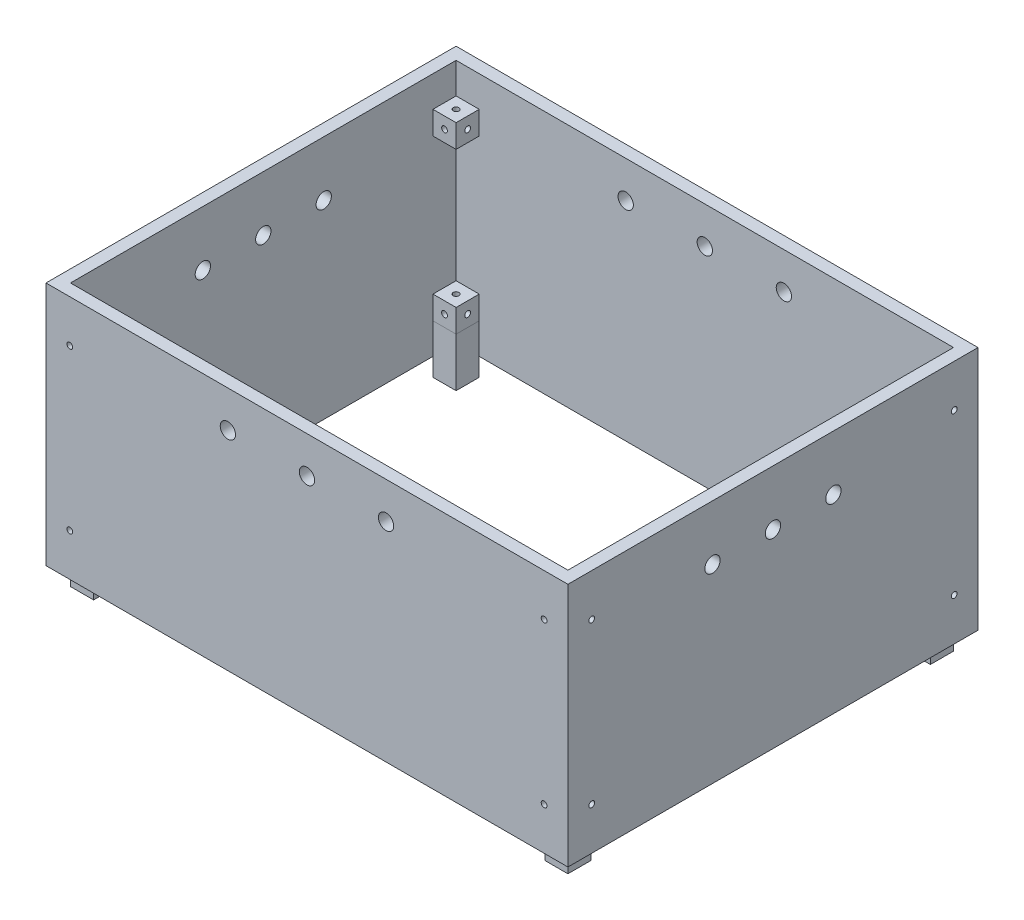
from build123d import *

# Parameters (mm, degrees)
SKETCH1_W            = 270.7
SKETCH1_H            = 212.7
SKETCH1_W_2          = 258
SKETCH1_H_2          = 200
WALLS_DEPTH          = 127
SKETCH2_R            = 3.96875
RODHOLESHEIGHT_DEPTH = 367.945200268
SKETCH4_R            = 3.96875
RODHOLESWIDTH_DEPTH  = 367.945200268
SKETCH3_W            = 12
SKETCH3_H            = 12
MODDINGCUBE_DEPTH    = 12
SKETCH11_R           = 1.5
CUT_EXTRUDE1_DEPTH   = 357.622226593
SKETCH17_R           = 1.5
CUT_EXTRUDE4_DEPTH   = 359.218899557
SKETCH15_R           = 1.5
CUT_EXTRUDE2_DEPTH   = 354.625243019
SKETCH18_W           = 12
SKETCH18_H           = 12
PEGS_DEPTH           = 25.4
PEGS_2_DEPTH         = 25.4
PEGS_3_DEPTH         = 25.4
PEGS_4_DEPTH         = 25.4


with BuildPart() as part:
    # Sketch1 → Walls (new body)
    with BuildSketch(Plane(origin=(0, 0, 0), x_dir=(1, 0, 0), z_dir=(0, 1, 0))):
        with Locations((135.35, 106.35)):
            Rectangle(SKETCH1_W, SKETCH1_H)
        with Locations((135.35, 106.35)):
            Rectangle(SKETCH1_W_2, SKETCH1_H_2, mode=Mode.SUBTRACT)
    extrude(amount=WALLS_DEPTH)

    # Sketch2 → RodHolesHeight (cut, through all)
    with BuildSketch(Plane.XY):
        with Locations((135.35, 107.95)):
            Circle(SKETCH2_R)
        with Locations((94.33, 107.95)):
            Circle(SKETCH2_R)
        with Locations((176.366666667, 107.95)):
            Circle(SKETCH2_R)
    extrude(amount=-RODHOLESHEIGHT_DEPTH, mode=Mode.SUBTRACT)

    # Sketch4 → RodHolesWidth (cut, through all)
    with BuildSketch(Plane.ZY):
        with Locations((-106.35, 98.425)):
            Circle(SKETCH4_R)
        with Locations((-137.7, 98.425)):
            Circle(SKETCH4_R)
        with Locations((-75, 98.425)):
            Circle(SKETCH4_R)
    extrude(amount=-RODHOLESWIDTH_DEPTH, mode=Mode.SUBTRACT)

    # Sketch3 → ModdingCube (add)
    with BuildSketch(Plane(origin=(0, 0, -6.35), x_dir=(-1, 0, 0), z_dir=(0, 0, -1))):
        with Locations((-258.35, 105)):
            Rectangle(SKETCH3_W, SKETCH3_H)
        with Locations((-258.35, 22)):
            Rectangle(SKETCH3_W, SKETCH3_H)
        with Locations((-12.35, 105)):
            Rectangle(SKETCH3_W, SKETCH3_H)
        with Locations((-12.35, 22)):
            Rectangle(SKETCH3_W, SKETCH3_H)
    moddingcube = extrude(amount=MODDINGCUBE_DEPTH)

    # Sketch11 → Cut-Extrude1 (cut, symmetric)
    with BuildSketch(Plane(origin=(0, 0, -18.35), x_dir=(-1, 0, 0), z_dir=(0, 0, -1))):
        with Locations((-258.35, 105)):
            Circle(SKETCH11_R)
        with Locations((-258.35, 22)):
            Circle(SKETCH11_R)
        with Locations((-12.35, 105)):
            Circle(SKETCH11_R)
        with Locations((-12.35, 22)):
            Circle(SKETCH11_R)
    cut_extrude1 = extrude(amount=CUT_EXTRUDE1_DEPTH, both=True, mode=Mode.SUBTRACT)

    # Sketch17 → Cut-Extrude4 (cut, symmetric)
    with BuildSketch(Plane(origin=(0, 28, 0), x_dir=(1, 0, 0), z_dir=(0, 1, 0))):
        with Locations((12.35, 12.35)):
            Circle(SKETCH17_R)
        with Locations((258.35, 12.35)):
            Circle(SKETCH17_R)
    cut_extrude4 = extrude(amount=CUT_EXTRUDE4_DEPTH, both=True, mode=Mode.SUBTRACT)

    # Sketch15 → Cut-Extrude2 (cut, symmetric)
    with BuildSketch(Plane.ZY.offset(-252.35)):
        with Locations((-12.35, 105)):
            Circle(SKETCH15_R)
        with Locations((-12.35, 22)):
            Circle(SKETCH15_R)
    cut_extrude2 = extrude(amount=CUT_EXTRUDE2_DEPTH, both=True, mode=Mode.SUBTRACT)

    # Mirror6: ModdingCube, Cut-Extrude1, Cut-Extrude4, Cut-Extrude2 across plane
    add(moddingcube.mirror(Plane(origin=(0, 0, -106.35), x_dir=(1, 0, 0), z_dir=(0, 0, -1))))
    add(cut_extrude1.mirror(Plane(origin=(0, 0, -106.35), x_dir=(1, 0, 0), z_dir=(0, 0, -1))), mode=Mode.SUBTRACT)
    add(cut_extrude4.mirror(Plane(origin=(0, 0, -106.35), x_dir=(1, 0, 0), z_dir=(0, 0, -1))), mode=Mode.SUBTRACT)
    add(cut_extrude2.mirror(Plane(origin=(0, 0, -106.35), x_dir=(1, 0, 0), z_dir=(0, 0, -1))), mode=Mode.SUBTRACT)


with BuildPart() as body_2:
    # Sketch18 → Pegs (new body)
    with BuildSketch(Plane.XZ.offset(-16)):
        with Locations((12.35, -12.35)):
            Rectangle(SKETCH18_W, SKETCH18_H)
    extrude(amount=PEGS_DEPTH)


with BuildPart() as body_3:
    # Sketch18 → Pegs 2 (new body)
    with BuildSketch(Plane.XZ.offset(-16)):
        with Locations((12.35, -200.35)):
            Rectangle(SKETCH18_W, SKETCH18_H)
    extrude(amount=PEGS_2_DEPTH)


with BuildPart() as body_4:
    # Sketch18 → Pegs 3 (new body)
    with BuildSketch(Plane.XZ.offset(-16)):
        with Locations((258.35, -200.35)):
            Rectangle(SKETCH18_W, SKETCH18_H)
    extrude(amount=PEGS_3_DEPTH)


with BuildPart() as body_5:
    # Sketch18 → Pegs 4 (new body)
    with BuildSketch(Plane.XZ.offset(-16)):
        with Locations((258.35, -12.35)):
            Rectangle(SKETCH18_W, SKETCH18_H)
    extrude(amount=PEGS_4_DEPTH)


solid = Compound([part.part, body_2.part, body_3.part, body_4.part, body_5.part])
